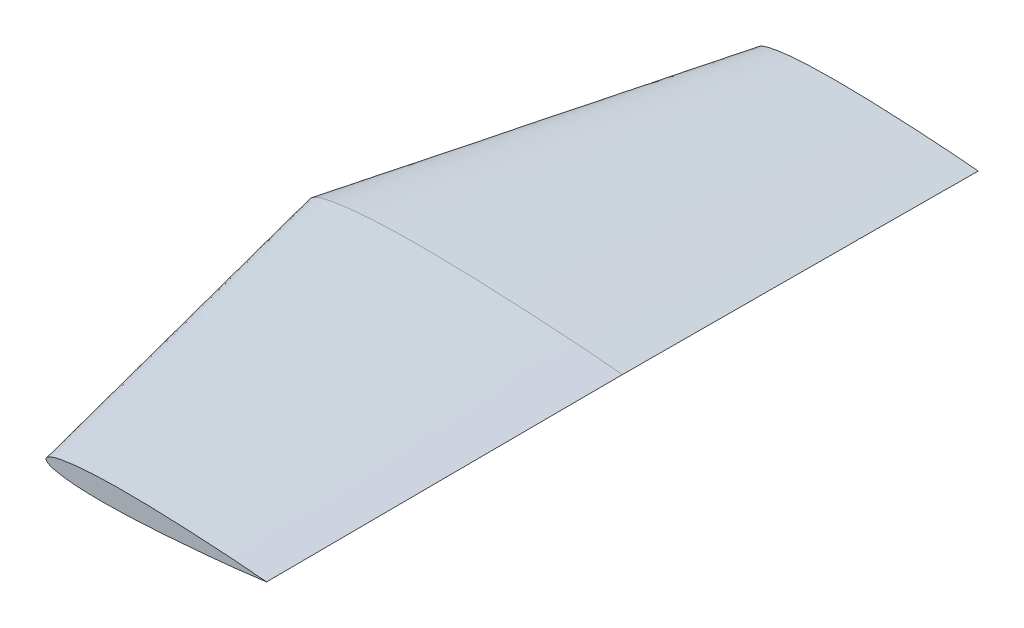
from build123d import *


with BuildPart() as part:
    # Loft1: read off the stored shape, not the designer's step
    # Loft1: loft between two sections, ruled curve by curve
    loft1_from = [
        Edge.make_bspline([(0.011637759, 0.178315279, 0), (0.003123692, 0.118971259, 0), (-0.009514762, -0.061836013, 0), (0.054547368, -0.388279894, 0), (0.287167896, -0.871788046, 0), (0.610154957, -1.309180514, 0), (1.134545544, -1.859688863, 0), (1.646574488, -2.29193601, 0), (2.473591859, -2.876623915, 0), (3.160400183, -3.269534802, 0), (4.292324282, -3.817852205, 0), (5.143103729, -4.15650879, 0), (6.57679174, -4.650362429, 0), (7.583755856, -4.943673584, 0), (9.312479962, -5.388088016, 0), (10.468299012, -5.645055244, 0), (12.48539135, -6.050016515, 0), (13.78562074, -6.282704631, 0), (16.08248306, -6.65664541, 0), (17.521040721, -6.866386921, 0), (20.086457363, -7.206950363, 0), (21.657012842, -7.393879848, 0), (24.48057783, -7.696049989, 0), (26.178597623, -7.856038563, 0), (29.248564648, -8.111408028, 0), (31.066419047, -8.241446679, 0), (34.367835248, -8.447282849, 0), (36.297895127, -8.549232181, 0), (39.815854378, -8.70532951, 0), (41.850655085, -8.777648467, 0), (45.569597497, -8.883719537, 0), (47.700862992, -8.92914179, 0), (51.60514699, -8.985521436, 0), (53.825413917, -9.001710178, 0), (57.897973745, -9.00902917, 0), (60.197548895, -9.000350452, 0), (64.419016615, -8.959403187, 0), (66.788162549, -8.921861752, 0), (71.139935688, -8.832022851, 0), (73.569743285, -8.770121421, 0), (78.033278855, -8.636944754, 0), (80.514083321, -8.551943713, 0), (87.474605032, -8.285636863, 0), (92.400128306, -8.057129037, 0), (101.885992615, -7.557546116, 0), (106.892949425, -7.262165077, 0), (116.459431551, -6.646056027, 0), (121.465323517, -6.296700276, 0), (130.947582451, -5.59311249, 0), (135.87007432, -5.206640336, 0), (145.103147778, -4.446103168, 0), (149.85961563, -4.036633273, 0), (158.683404693, -3.248941714, 0), (163.196384342, -2.832533298, 0), (171.45684239, -2.044527956, 0), (175.64979582, -1.632359105, 0), (183.20610697, -0.869471445, 0), (187.014549067, -0.475841913, 0), (193.725529067, 0.237464543, 0), (197.073814733, 0.602066645, 0), (202.853438727, 1.249726901, 0), (205.726590667, 1.579350053, 0), (210.381177933, 2.139926762, 0), (212.619031591, 2.420331547, 0), (216.310079511, 2.881770467, 0), (218.165233296, 3.112879795, 0), (220.272208792, 3.436911019, 0), (221.104130809, 3.588322562, 0), (222.546679901, 3.760037518, 0), (223.249239951, 3.834328642, 0), (223.613495217, 3.906309032, 0), (223.209507684, 3.96175874, 0), (221.53469121, 4.081334272, 0), (220.609469524, 4.20374367, 0), (218.590259042, 4.458145193, 0), (216.755632315, 4.626485189, 0), (213.017790603, 4.961462471, 0), (210.763490097, 5.164971354, 0), (206.102762048, 5.564914911, 0), (203.22232523, 5.795192056, 0), (197.420641424, 6.242672116, 0), (194.061059224, 6.491140997, 0), (187.330294323, 6.971336805, 0), (183.510682617, 7.232619967, 0), (175.932186281, 7.732806951, 0), (171.727402586, 7.999245105, 0), (163.444654668, 8.500228999, 0), (158.919960367, 8.759817706, 0), (150.07413354, 9.240875576, 0), (145.306322218, 9.485147711, 0), (136.052441726, 9.925193158, 0), (131.119516218, 10.14088241, 0), (121.618578402, 10.515651426, 0), (116.603594666, 10.691583966, 0), (107.021533125, 10.976598897, 0), (102.007361306, 11.098852099, 0), (92.509911273, 11.270749974, 0), (87.579436421, 11.329421323, 0), (80.613873113, 11.356173939, 0), (78.131612369, 11.355874251, 0), (73.666136551, 11.335718614, 0), (71.23563567, 11.314237166, 0), (66.883342382, 11.254893734, 0), (64.514295641, 11.211455468, 0), (60.293884587, 11.108533898, 0), (57.995352189, 11.038789655, 0), (53.925416011, 10.892489035, 0), (51.706980838, 10.800822238, 0), (47.806849261, 10.612233302, 0), (45.678342694, 10.494707117, 0), (41.96511713, 10.262935477, 0), (39.933901335, 10.122162269, 0), (36.423152358, 9.848276626, 0), (34.497575945, 9.68190066, 0), (31.204855241, 9.366199177, 0), (29.392292732, 9.176105366, 0), (26.332376999, 8.820066073, 0), (24.640484691, 8.604712643, 0), (21.828226092, 8.211011423, 0), (20.264522028, 7.973480489, 0), (17.711369145, 7.550777645, 0), (16.280147972, 7.295685743, 0), (13.996047762, 6.850486399, 0), (12.703468804, 6.578473706, 0), (10.699297507, 6.114110407, 0), (9.550936296, 5.825453238, 0), (7.834215763, 5.337257706, 0), (6.83395896, 5.021681416, 0), (5.410273807, 4.500985836, 0), (4.563703304, 4.151317987, 0), (3.435986878, 3.595621722, 0), (2.748551715, 3.20360564, 0), (1.917247324, 2.627849896, 0), (1.396643117, 2.204214986, 0), (0.856066786, 1.66734797, 0), (0.505103109, 1.255977757, 0), (0.230996762, 0.81372919, 0), (0.076529063, 0.472942356, 0), (0.024169656, 0.265664027, 0), (0.011637759, 0.178315279, 0)], [0, 0, 0, 0, 0.0004, 0.001214878, 0.00220364, 0.003818965, 0.004807727, 0.007256074, 0.008244836, 0.011502686, 0.012491448, 0.016577885, 0.017566647, 0.022540254, 0.023529016, 0.029401201, 0.030389963, 0.037170797, 0.038159559, 0.045821826, 0.046810587, 0.055321062, 0.056309824, 0.065641924, 0.066630686, 0.076738631, 0.077727392, 0.088566601, 0.089555363, 0.101079965, 0.102068727, 0.114227798, 0.11521656, 0.12796312, 0.128951881, 0.142224136, 0.143212898, 0.156948393, 0.157937155, 0.172078296, 0.173067058, 0.18755084, 0.188539602, 0.219260369, 0.220249131, 0.251533043, 0.252521805, 0.283821864, 0.284810626, 0.315577321, 0.316566083, 0.34624868, 0.347237442, 0.375313749, 0.376302511, 0.402270421, 0.403259183, 0.426655145, 0.427643907, 0.448054944, 0.449043706, 0.466092125, 0.467080887, 0.48046675, 0.481455512, 0.490923083, 0.491911845, 0.49727781, 0.498266572, 0.499411238, 0.5004, 0.501544666, 0.502533428, 0.507899393, 0.508888155, 0.518355726, 0.519344488, 0.532730351, 0.533719113, 0.550767532, 0.551756294, 0.572167331, 0.573156093, 0.596552055, 0.597540817, 0.623508727, 0.624497489, 0.652573796, 0.653562558, 0.683245155, 0.684233917, 0.715000612, 0.715989374, 0.747289433, 0.748278195, 0.779562107, 0.780550869, 0.811271636, 0.812260398, 0.826744181, 0.827732942, 0.841874083, 0.842862845, 0.85659834, 0.857587102, 0.870859357, 0.871848119, 0.884594678, 0.88558344, 0.897742511, 0.898731273, 0.910255875, 0.911244637, 0.922083846, 0.923072608, 0.933180552, 0.934169314, 0.943501414, 0.944490176, 0.953000651, 0.953989413, 0.961651679, 0.962640441, 0.969421275, 0.970410037, 0.976282222, 0.977270984, 0.982244591, 0.983233353, 0.98731979, 0.988308552, 0.991566402, 0.992555164, 0.995003512, 0.995992273, 0.997607598, 0.99859636, 0.999411238, 1, 1, 1, 1], 3),
    ]
    loft1_to = [
        Edge.make_bspline([(66.06511285, -0.183950088, 254), (66.075321097, -0.225261642, 254), (66.114756817, -0.349757492, 254), (66.22265678, -0.567280144, 254), (66.426533649, -0.871934749, 254), (66.683767769, -1.152957613, 254), (67.077596994, -1.517682568, 254), (67.454579338, -1.803170035, 254), (68.054071124, -2.188128672, 254), (68.547744405, -2.447250722, 254), (69.355451499, -2.810796891, 254), (69.960133291, -3.036187997, 254), (70.975376172, -3.367812251, 254), (71.687432735, -3.565420054, 254), (72.908207473, -3.86695526, 254), (73.723884863, -4.041967239, 254), (75.146472365, -4.319653861, 254), (76.063286558, -4.479400127, 254), (77.682505352, -4.736710127, 254), (78.69652373, -4.881133214, 254), (80.504633737, -5.115987519, 254), (81.611503679, -5.244788117, 254), (83.601341135, -5.452850943, 254), (84.797925198, -5.562884071, 254), (86.961216028, -5.738339057, 254), (88.24214485, -5.827619404, 254), (90.56836561, -5.968947608, 254), (91.92828618, -6.038749017, 254), (94.406996012, -6.145273067, 254), (95.840669462, -6.194449666, 254), (98.460910841, -6.266342011, 254), (99.962516701, -6.296757791, 254), (102.713299856, -6.333648793, 254), (104.277590073, -6.343645367, 254), (107.146895612, -6.346585276, 254), (108.767044549, -6.339176369, 254), (111.741235279, -6.307872465, 254), (113.410387693, -6.280207265, 254), (116.476367338, -6.214976527, 254), (118.188250731, -6.170340124, 254), (121.332960475, -6.074733658, 254), (123.080768007, -6.013910147, 254), (127.984676623, -5.823801961, 254), (131.45486153, -5.661258605, 254), (138.137943896, -5.306696538, 254), (141.66549783, -5.097326201, 254), (148.405375182, -4.661036123, 254), (151.932180918, -4.413849327, 254), (158.612730835, -3.916356631, 254), (162.080780489, -3.643194159, 254), (168.585768292, -3.105813981, 254), (171.936855558, -2.816585709, 254), (178.153517713, -2.260361357, 254), (181.333045721, -1.966326268, 254), (187.152744912, -1.40991682, 254), (190.106850244, -1.118924976, 254), (195.430694036, -0.580392982, 254), (198.113720258, -0.302501569, 254), (202.841154108, 0.201110053, 254), (205.200581153, 0.458667387, 254), (209.274638317, 0.916398812, 254), (211.29713861, 1.149365687, 254), (214.568999109, 1.545571745, 254), (216.151284827, 1.744295035, 254), (218.774923454, 2.072065093, 254), (220.062574781, 2.235706341, 254), (221.478078426, 2.464483507, 254), (222.126532227, 2.573423567, 254), (223.30285759, 2.698799503, 254), (223.585948369, 2.747775904, 254), (223.327700438, 2.789502056, 254), (222.831189789, 2.8245369, 254), (221.811245335, 2.90997439, 254), (221.221752562, 2.996130187, 254), (219.730229476, 3.172478935, 254), (218.418302942, 3.289591728, 254), (215.808030077, 3.523741851, 254), (214.225426247, 3.666154443, 254), (210.934272031, 3.946417319, 254), (208.903134153, 4.107864472, 254), (204.817682043, 4.421781569, 254), (202.451134708, 4.596175247, 254), (197.708285559, 4.933414458, 254), (195.017020863, 5.116932366, 254), (189.677741186, 5.468297268, 254), (186.715279956, 5.655414538, 254), (180.879581394, 6.007151447, 254), (177.691680255, 6.18938497, 254), (171.459338879, 6.527049596, 254), (168.100164342, 6.698410637, 254), (161.580306846, 7.006891815, 254), (158.104797573, 7.157977528, 254), (151.410884819, 7.420232677, 254), (147.87756481, 7.543133461, 254), (141.126500088, 7.741722506, 254), (137.593757451, 7.826592635, 254), (130.902322223, 7.94511599, 254), (127.428562559, 7.984901913, 254), (122.520997985, 8.001265628, 254), (120.772133182, 8.000117524, 254), (117.626010605, 7.984138712, 254), (115.913621506, 7.967979722, 254), (112.847258276, 7.924234129, 254), (111.178181011, 7.892414436, 254), (108.204770106, 7.817447433, 254), (106.585388447, 7.767015658, 254), (103.718012796, 7.661724988, 254), (102.155084794, 7.595733683, 254), (99.407401208, 7.460036222, 254), (97.907859364, 7.375649518, 254), (95.291899631, 7.209520749, 254), (93.860941557, 7.108567542, 254), (91.387727396, 6.9121563, 254), (90.031247602, 6.792915261, 254), (87.711727917, 6.566806515, 254), (86.434944495, 6.430546269, 254), (84.279609878, 6.175251261, 254), (83.087940369, 6.020849315, 254), (81.107252181, 5.738659793, 254), (80.005994799, 5.568422441, 254), (78.208017086, 5.265546995, 254), (77.200262423, 5.082492925, 254), (75.592198868, 4.762719243, 254), (74.682407607, 4.566909349, 254), (73.272097387, 4.232172697, 254), (72.464584777, 4.022818288, 254), (71.258289405, 3.667392503, 254), (70.556481611, 3.43610783, 254), (69.559141576, 3.053125526, 254), (68.968420914, 2.793752712, 254), (68.184896929, 2.379841441, 254), (67.71096502, 2.086299059, 254), (67.143025109, 1.65427586, 254), (66.793125417, 1.337333701, 254), (66.437429529, 0.936817955, 254), (66.220763816, 0.620901108, 254), (66.068860553, 0.274735414, 254), (66.028603777, 0.023481726, 254), (66.050087282, -0.123143414, 254), (66.06511285, -0.183950088, 254)], [0, 0, 0, 0, 0.0004, 0.001214878, 0.00220364, 0.003818965, 0.004807727, 0.007256074, 0.008244836, 0.011502686, 0.012491448, 0.016577885, 0.017566647, 0.022540254, 0.023529016, 0.029401201, 0.030389963, 0.037170797, 0.038159559, 0.045821826, 0.046810587, 0.055321062, 0.056309824, 0.065641924, 0.066630686, 0.076738631, 0.077727392, 0.088566601, 0.089555363, 0.101079965, 0.102068727, 0.114227798, 0.11521656, 0.12796312, 0.128951881, 0.142224136, 0.143212898, 0.156948393, 0.157937155, 0.172078296, 0.173067058, 0.18755084, 0.188539602, 0.219260369, 0.220249131, 0.251533043, 0.252521805, 0.283821864, 0.284810626, 0.315577321, 0.316566083, 0.34624868, 0.347237442, 0.375313749, 0.376302511, 0.402270421, 0.403259183, 0.426655145, 0.427643907, 0.448054944, 0.449043706, 0.466092125, 0.467080887, 0.48046675, 0.481455512, 0.490923083, 0.491911845, 0.49727781, 0.498266572, 0.499411238, 0.5004, 0.501544666, 0.502533428, 0.507899393, 0.508888155, 0.518355726, 0.519344488, 0.532730351, 0.533719113, 0.550767532, 0.551756294, 0.572167331, 0.573156093, 0.596552055, 0.597540817, 0.623508727, 0.624497489, 0.652573796, 0.653562558, 0.683245155, 0.684233917, 0.715000612, 0.715989374, 0.747289433, 0.748278195, 0.779562107, 0.780550869, 0.811271636, 0.812260398, 0.826744181, 0.827732942, 0.841874083, 0.842862845, 0.85659834, 0.857587102, 0.870859357, 0.871848119, 0.884594678, 0.88558344, 0.897742511, 0.898731273, 0.910255875, 0.911244637, 0.922083846, 0.923072608, 0.933180552, 0.934169314, 0.943501414, 0.944490176, 0.953000651, 0.953989413, 0.961651679, 0.962640441, 0.969421275, 0.970410037, 0.976282222, 0.977270984, 0.982244591, 0.983233353, 0.98731979, 0.988308552, 0.991566402, 0.992555164, 0.995003512, 0.995992273, 0.997607598, 0.99859636, 0.999411238, 1, 1, 1, 1], 3),
    ]
    loft1 = Solid(Shell([*[Face.make_surface_from_curves(loft1_from[k], loft1_to[k]) for k in range(1)], Face(Wire(loft1_from)), Face(Wire(loft1_to))]))
    add(loft1)

    # Mirror1: Loft1 across plane
    add(loft1.mirror(Plane(origin=(0, 0, 0), x_dir=(1, 0, 0), z_dir=(0, 0, -1))))


solid = part.part
